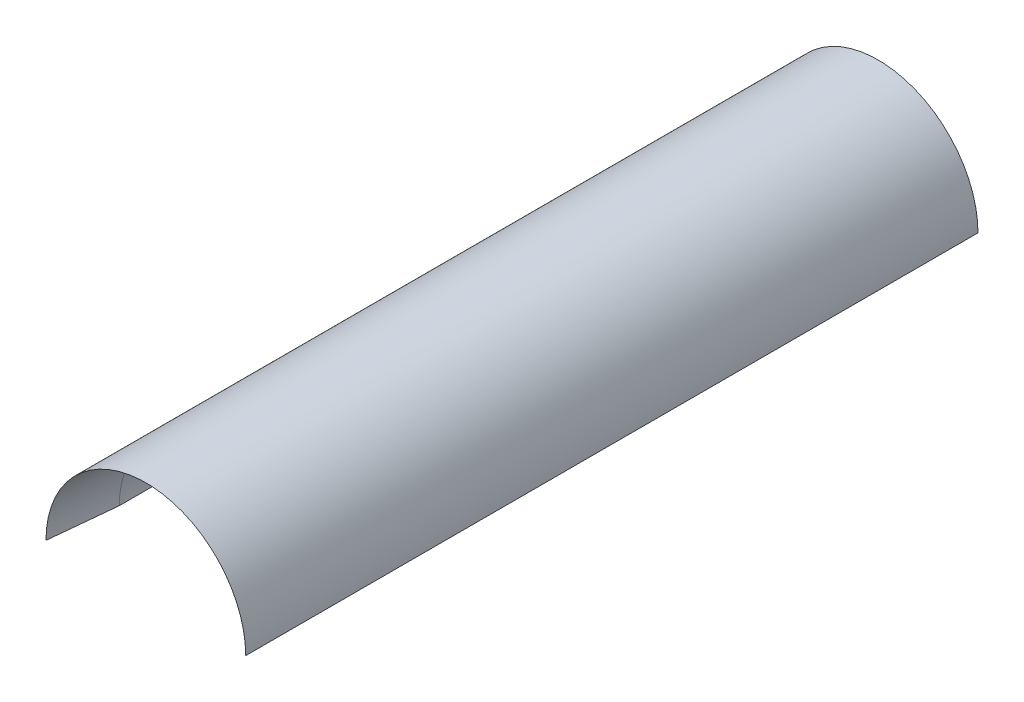
from build123d import *

# Parameters (mm, degrees)
BOSS_EXTRUDE1_DEPTH = 220
CHAMFER1_SIZE       = 20
CHAMFER1_SIZE_2     = 2


with BuildPart() as part:
    # Sketch1 → Boss-Extrude1 (new body)
    with BuildSketch(Plane.XY):
        with BuildLine():
            ThreePointArc((28, 0), (0, 28), (-28, 0))
            Line((-28, 0), (-30, 0))
            ThreePointArc((-30, 0), (0, 30), (30, 0))
            Line((30, 0), (28, 0))
        make_face()
    extrude(amount=BOSS_EXTRUDE1_DEPTH)

    # Chamfer1
    # the kernel refuses this chamfer: 20, 2 mm, written as the material it takes off along each edge
    with BuildSketch(Plane(origin=(0, 0, 220), x_dir=(0.0031415874858789516, -0.9999950652018582, 0), z_dir=(-0.9999950652018582, -0.0031415874858789516, 0))) as chamfer1_piece_1:
        Polygon((28, -CHAMFER1_SIZE), (28 + CHAMFER1_SIZE_2, 0), (28, 0), align=None)
    revolve(axis=Axis((0, 0, 220), (0, 0, 1)), revolution_arc=359.64, mode=Mode.SUBTRACT)


solid = part.part
